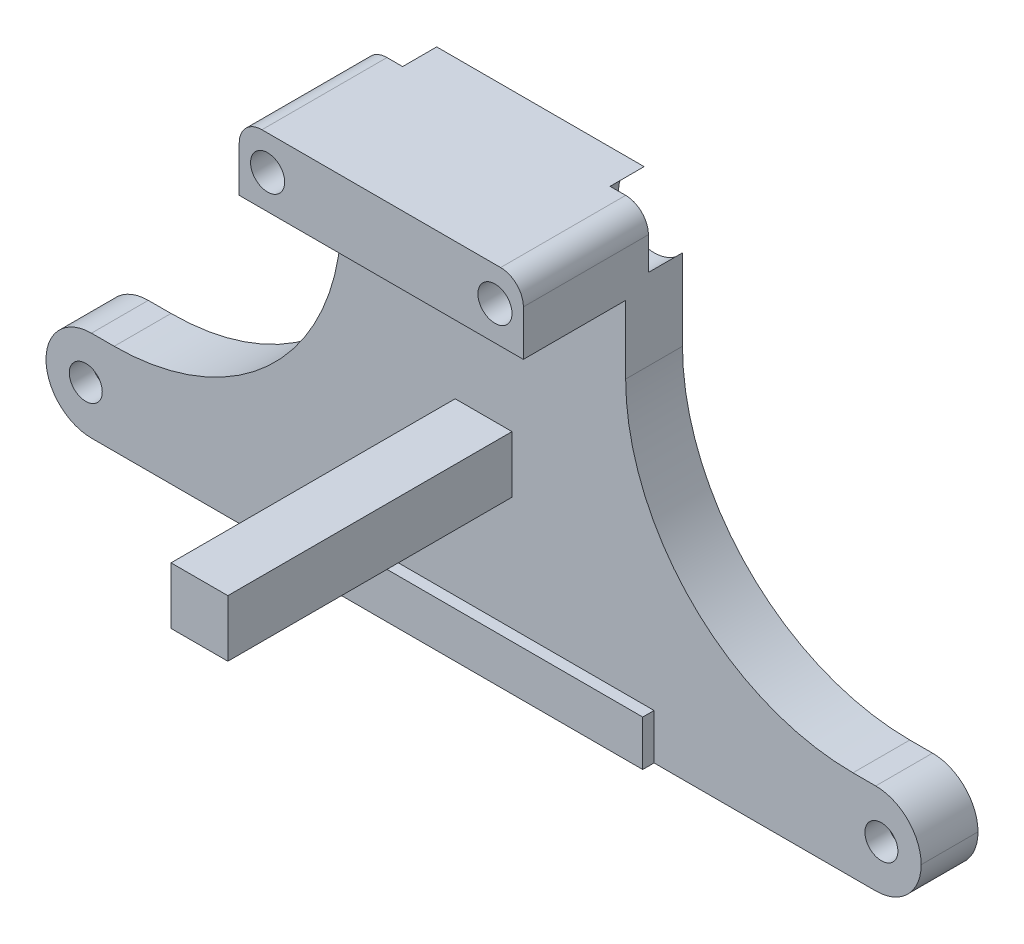
from build123d import *

# Parameters (mm, degrees)
SKETCH_1_W          = 77
SKETCH_1_H          = 8
SKETCH_1_R          = 1.45
EXTRUDE_1_DEPTH     = 5
SKETCH_2_W          = 25
SKETCH_2_H          = 32
SKETCH_2_R          = 1.5
EXTRUDE_2_DEPTH     = 5
SKETCH_3_W          = 25
SKETCH_3_H          = 6
SKETCH_3_R          = 1.5
EXTRUDE_3_DEPTH     = 9
FILLET_1_R          = 20
FILLET_2_R          = 4
FILLET_3_R          = 2
SKETCH_4_R          = 3.125
CUT_EXTRUDE_3_DEPTH = 3
SKETCH_5_W          = 30
SKETCH_5_H          = 4
EXTRUDE_4_DEPTH     = 1
SKETCH_6_W          = 5
SKETCH_6_H          = 5
EXTRUDE_5_DEPTH     = 25


with BuildPart() as part:
    # Эскиз1 → Бобышка-Вытянуть1 (new body)
    with BuildSketch(Plane.XY):
        Rectangle(SKETCH_1_W, SKETCH_1_H)
        with Locations((-35, 0)):
            Circle(SKETCH_1_R, mode=Mode.SUBTRACT)
        with Locations((35, 0)):
            Circle(SKETCH_1_R, mode=Mode.SUBTRACT)
    extrude(amount=EXTRUDE_1_DEPTH)

    # Эскиз2 → Бобышка-Вытянуть2 (add)
    with BuildSketch(Plane(origin=(0, 0, 0), x_dir=(-1, 0, 0), z_dir=(0, 0, -1))):
        with Locations((0, 20)):
            Rectangle(SKETCH_2_W, SKETCH_2_H)
        with Locations((-10, 33)):
            Circle(SKETCH_2_R, mode=Mode.SUBTRACT)
        with Locations((10, 33)):
            Circle(SKETCH_2_R, mode=Mode.SUBTRACT)
    extrude(amount=-EXTRUDE_2_DEPTH)

    # Эскиз3 → Бобышка-Вытянуть3 (add)
    with BuildSketch(Plane(origin=(0, 0, 5), x_dir=(-1, 0, 0), z_dir=(0, 0, -1))):
        with Locations((0, 33)):
            Rectangle(SKETCH_3_W, SKETCH_3_H)
        with Locations((10, 33)):
            Circle(SKETCH_3_R, mode=Mode.SUBTRACT)
        with Locations((-10, 33)):
            Circle(SKETCH_3_R, mode=Mode.SUBTRACT)
    extrude(amount=-EXTRUDE_3_DEPTH)

    # Скругление1
    fillet_1_edges = [part.edges().sort_by_distance(p)[0] for p in [
        (12.5, 4, 2.5),
        (-12.5, 4, 2.5),
    ]]
    fillet(fillet_1_edges, radius=FILLET_1_R)

    # Скругление2
    fillet_2_edges = [part.edges().sort_by_distance(p)[0] for p in [
        (-38.5, -4, 2.5),
        (-38.5, 4, 2.5),
        (38.5, -4, 2.5),
        (38.5, 4, 2.5),
    ]]
    fillet(fillet_2_edges, radius=FILLET_2_R - 0.0001)  # a hair under: the kernel refuses the full size

    # Скругление3
    fillet_3_edges = [part.edges().sort_by_distance(p)[0] for p in [
        (12.5, 36, 7),
        (-12.5, 36, 7),
    ]]
    fillet(fillet_3_edges, radius=FILLET_3_R)

    # Эскиз4 → Вырез-Вытянуть3 (cut)
    with BuildSketch(Plane(origin=(0, 0, 0), x_dir=(-1, 0, 0), z_dir=(0, 0, -1))):
        with Locations((-10, 33)):
            Circle(SKETCH_4_R)
        with Locations((10, 33)):
            Circle(SKETCH_4_R)
        with Locations((-35, 0)):
            Circle(SKETCH_4_R)
        with Locations((35, 0)):
            Circle(SKETCH_4_R)
    extrude(amount=-CUT_EXTRUDE_3_DEPTH, mode=Mode.SUBTRACT)

    # Эскиз5 → Бобышка-Вытянуть4 (add)
    with BuildSketch(Plane.XY.offset(5)):
        with Locations((0, -2)):
            Rectangle(SKETCH_5_W, SKETCH_5_H)
    extrude(amount=EXTRUDE_4_DEPTH)

    # Эскиз6 → Бобышка-Вытянуть5 (add)
    with BuildSketch(Plane.XY.offset(5)):
        with Locations((0, 12.5)):
            Rectangle(SKETCH_6_W, SKETCH_6_H)
    extrude(amount=EXTRUDE_5_DEPTH)


solid = part.part
